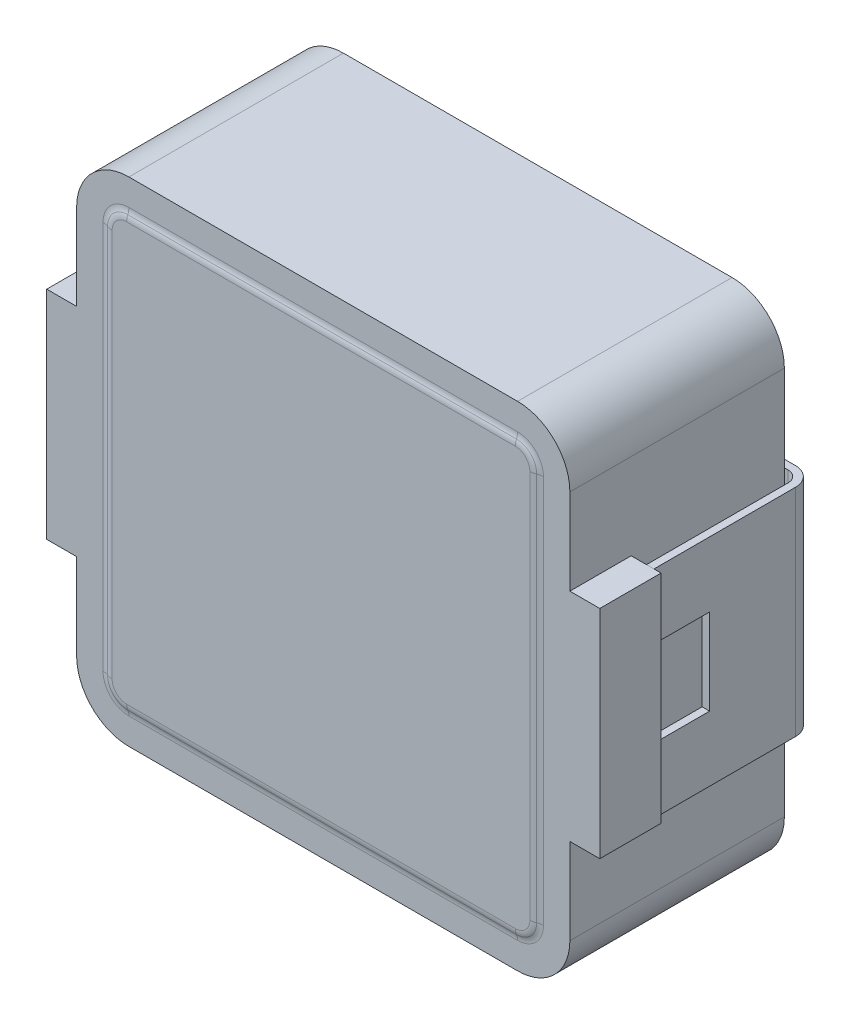
from build123d import *

# Parameters (mm, degrees)
SKETCH1_W            = 6.6
SKETCH1_H            = 6.6
BOSS_EXTRUDE1_DEPTH  = 2.9
SKETCH6_W            = 7.4
SKETCH6_H            = 2.9
BOSS_EXTRUDE5_DEPTH  = 0.85
FILLET1_R            = 0.7
SKETCH2_W            = 0.9
SKETCH2_H            = 2.1
CUT_EXTRUDE1_DEPTH   = 0.05
SKETCH3_W            = 1.3
SKETCH3_H            = 2.89
BOSS_EXTRUDE2_DEPTH  = 0.15
SKETCH4_W            = 0.3
SKETCH4_H            = 2.89
BOSS_EXTRUDE3_DEPTH  = 2
FILLET2_R            = 0.25
BOSS_EXTRUDE4_DEPTH  = 0.1
FILLET3_R            = 0.05
FILLET4_R            = 0.05
SKETCH8_W            = 0.2
SKETCH8_H            = 2.89
CUT_EXTRUDE2_DEPTH   = 2.05
FILLET5_R            = 0.15
SKETCH9_W            = 0.75
SKETCH9_H            = 1.15
CUT_EXTRUDE3_DEPTH   = 0.1
FILLET2_OF_MIRROR2_R = 0.25
FILLET5_OF_MIRROR2_R = 0.15
SKETCH10_W           = 10
SKETCH10_H           = 10
CUT_EXTRUDE4_DEPTH   = 0.03
FILLET6_R            = 0.2
FILLET7_R            = 0.2


# Some blends are built 0.0001 mm under size
with BuildPart() as part:
    # Sketch1 → Boss-Extrude1 (new body)
    with BuildSketch(Plane.XY):
        Rectangle(SKETCH1_W, SKETCH1_H)
    extrude(amount=BOSS_EXTRUDE1_DEPTH)

    # Sketch6 → Boss-Extrude5 (add)
    with BuildSketch(Plane.XY.offset(2.9)):
        Rectangle(SKETCH6_W, SKETCH6_H)
    extrude(amount=-BOSS_EXTRUDE5_DEPTH)

    # Fillet1
    fillet1_edges = [part.edges().sort_by_distance(p)[0] for p in [
        (3.3, -3.3, 1.45),
        (-3.3, -3.3, 1.45),
        (-3.3, 3.3, 1.45),
        (3.3, 3.3, 1.45),
    ]]
    fillet(fillet1_edges, radius=FILLET1_R)

    # Sketch2 → Cut-Extrude1 (cut)
    with BuildSketch(Plane(origin=(0, 0, 0), x_dir=(-1, 0, 0), z_dir=(0, 0, -1))):
        with Locations((2.85, 0)):
            Rectangle(SKETCH2_W, SKETCH2_H)
        with Locations((-2.85, 0)):
            Rectangle(SKETCH2_W, SKETCH2_H)
    extrude(amount=-CUT_EXTRUDE1_DEPTH, mode=Mode.SUBTRACT)

    # Sketch3 → Boss-Extrude2 (add)
    with BuildSketch(Plane(origin=(0, 0, 0.05), x_dir=(-1, 0, 0), z_dir=(0, 0, -1))):
        with Locations((2.95, 0)):
            Rectangle(SKETCH3_W, SKETCH3_H)
    boss_extrude2 = extrude(amount=BOSS_EXTRUDE2_DEPTH)

    # Sketch4 → Boss-Extrude3 (add)
    with BuildSketch(Plane.XY.offset(0.05)):
        with Locations((-3.45, 0)):
            Rectangle(SKETCH4_W, SKETCH4_H)
    boss_extrude3 = extrude(amount=BOSS_EXTRUDE3_DEPTH)

    # Fillet2
    fillet2_edges = [part.edges().sort_by_distance(p)[0] for p in [
        (-3.6, 0, -0.1),
    ]]
    fillet(fillet2_edges, radius=FILLET2_R)

    # Sketch5 → Boss-Extrude4 (add)
    with BuildSketch(Plane(origin=(0, 0, 0), x_dir=(-1, 0, 0), z_dir=(0, 0, -1))):
        Polygon((2.725, -2.7), (-2.725, -2.7), (-2.725, -1.8), (-1, -1.8), (-1, 1.8), (-2.725, 1.8), (-2.725, 2.7), (2.725, 2.7), (2.725, 1.8), (1, 1.8), (1, -1.8), (2.725, -1.8), align=None)
    extrude(amount=BOSS_EXTRUDE4_DEPTH)

    # Fillet3
    fillet3_edges = [part.edges().sort_by_distance(p)[0] for p in [
        (-2.725, -2.25, -0.1),
        (-1.8625, -1.8, -0.1),
        (-1, 0, -0.1),
        (-1.8625, 1.8, -0.1),
        (-2.725, 2.25, -0.1),
        (0, 2.7, -0.1),
        (2.725, 2.25, -0.1),
        (1.8625, 1.8, -0.1),
        (1, 0, -0.1),
        (1.8625, -1.8, -0.1),
        (2.725, -2.25, -0.1),
        (0, -2.7, -0.1),
    ]]
    fillet(fillet3_edges, radius=FILLET3_R)

    # Fillet4
    fillet4_edges = [part.edges().sort_by_distance(p)[0] for p in [
        (-1.8625, 1.8, 0),
        (-2.725, 2.25, 0),
        (0, 2.7, 0),
        (2.725, 2.25, 0),
        (1.8625, 1.8, 0),
        (1, 0, 0),
        (1.8625, -1.8, 0),
        (2.725, -2.25, 0),
        (0, -2.7, 0),
        (-1, 0, 0),
        (-2.725, -2.25, 0),
        (-1.8625, -1.8, 0),
    ]]
    fillet(fillet4_edges, radius=FILLET4_R - 0.0001)  # a hair under: the kernel refuses the full size

    # Sketch8 → Cut-Extrude2 (cut)
    with BuildSketch(Plane(origin=(0, 0, 0), x_dir=(-1, 0, 0), z_dir=(0, 0, -1))):
        with Locations((3.4, 0)):
            Rectangle(SKETCH8_W, SKETCH8_H)
    cut_extrude2 = extrude(amount=-CUT_EXTRUDE2_DEPTH, mode=Mode.SUBTRACT)

    # Fillet5
    fillet5_edges = [part.edges().sort_by_distance(p)[0] for p in [
        (-3.5, 0, 0),
    ]]
    fillet(fillet5_edges, radius=FILLET5_R)

    # Sketch9 → Cut-Extrude3 (cut)
    with BuildSketch(Plane.ZY.offset(3.6)):
        with Locations((1.675, 0)):
            Rectangle(SKETCH9_W, SKETCH9_H)
    cut_extrude3 = extrude(amount=-CUT_EXTRUDE3_DEPTH, mode=Mode.SUBTRACT)

    # Mirror2: Boss-Extrude2, Boss-Extrude3, Cut-Extrude2, Cut-Extrude3 across plane
    add(boss_extrude2.mirror(Plane(origin=(0, 0, 0), x_dir=(0, 0, 1), z_dir=(1, 0, 0))))
    add(boss_extrude3.mirror(Plane(origin=(0, 0, 0), x_dir=(0, 0, 1), z_dir=(1, 0, 0))))
    add(cut_extrude2.mirror(Plane(origin=(0, 0, 0), x_dir=(0, 0, 1), z_dir=(1, 0, 0))), mode=Mode.SUBTRACT)
    add(cut_extrude3.mirror(Plane(origin=(0, 0, 0), x_dir=(0, 0, 1), z_dir=(1, 0, 0))), mode=Mode.SUBTRACT)

    # Fillet2 of Mirror2
    fillet2_of_mirror2_edges = [part.edges().sort_by_distance(p)[0] for p in [
        (3.6, 0, -0.1),
    ]]
    fillet(fillet2_of_mirror2_edges, radius=FILLET2_OF_MIRROR2_R)

    # Fillet5 of Mirror2
    fillet5_of_mirror2_edges = [part.edges().sort_by_distance(p)[0] for p in [
        (3.5, 0, 0),
    ]]
    fillet(fillet5_of_mirror2_edges, radius=FILLET5_OF_MIRROR2_R)

    # Sketch10 → Cut-Extrude4 (cut)
    with BuildSketch(Plane.XY.offset(2.9)):
        with Locations((0.5029938, 0.413168945)):
            Rectangle(SKETCH10_W, SKETCH10_H)
        with BuildLine():
            Line((-2.6, 2.9), (2.6, 2.9))
            ThreePointArc((2.6, 2.9), (2.812132034, 2.812132034), (2.9, 2.6))
            Line((2.9, 2.6), (2.9, -2.6))
            ThreePointArc((2.9, -2.6), (2.812132034, -2.812132034), (2.6, -2.9))
            Line((2.6, -2.9), (-2.6, -2.9))
            ThreePointArc((-2.6, -2.9), (-2.812132034, -2.812132034), (-2.9, -2.6))
            Line((-2.9, -2.6), (-2.9, 2.6))
            ThreePointArc((-2.9, 2.6), (-2.812132034, 2.812132034), (-2.6, 2.9))
        make_face(mode=Mode.SUBTRACT)
    extrude(amount=-CUT_EXTRUDE4_DEPTH, mode=Mode.SUBTRACT)

    # Fillet6
    # the kernel refuses this fillet: 0.2 mm, written as the material it takes off along each edge
    with BuildSketch(Plane(origin=(-2.6, -2.6, 2.9), x_dir=(0, -1, 0), z_dir=(1, 0, 0))) as fillet6_piece_1:
        with BuildLine():
            CenterArc((0.194643462, 0.2), FILLET6_R, 270, 31.788330618)
            Line((0.194643462, 0), (0.194643462, -0.004))
            Line((0.194643462, -0.004), (0.3, -0.004))
            Line((0.3, -0.004), (0.304, 0))
            ThreePointArc((0.304, 0), (0.304, 0.015), (0.302107131, 0.0266))
            Line((0.302107131, 0.0266), (0.3, 0.03))
        make_face()
    revolve(axis=Axis((-2.6, -2.6, 2.9), (0, 0, -1)), revolution_arc=90, mode=Mode.SUBTRACT)
    with BuildSketch(Plane(origin=(-2.9, -2.6, 2.9), x_dir=(1.837049031358635e-11, 0, -1.0), z_dir=(0, 1, 0)), Plane(origin=(-2.6, 2.9, 2.9), x_dir=(0, -1.837049031358635e-11, -1.0), z_dir=(1, 0, 0)), Plane(origin=(2.9, 2.6, 2.9), x_dir=(-1.837049031358635e-11, 0, -1.0), z_dir=(0, -1, 0)), Plane(origin=(2.6, -2.9, 2.9), x_dir=(0, 1.837049031358635e-11, -1.0), z_dir=(-1, 0, 0))) as fillet6_piece_2:
        with BuildLine():
            CenterArc((0.2, -0.105356538), FILLET6_R, 148.211669384, 31.788330618)
            Line((0, -0.105356538), (-0.004, -0.105356538))
            Line((-0.004, -0.105356538), (-0.004, 0))
            Line((-0.004, 0), (0, 0.004))
            ThreePointArc((0, 0.004), (0.015, 0.004), (0.0266, 0.002107131))
            Line((0.0266, 0.002107131), (0.03, 0))
        make_face()
    extrude(amount=5.2, mode=Mode.SUBTRACT)
    with BuildSketch(Plane(origin=(-2.6, 2.6, 2.9), x_dir=(-1, 0, 0), z_dir=(0, -1, 0))) as fillet6_piece_3:
        with BuildLine():
            CenterArc((0.194643462, 0.2), FILLET6_R, 270, 31.788330618)
            Line((0.194643462, 0), (0.194643462, -0.004))
            Line((0.194643462, -0.004), (0.3, -0.004))
            Line((0.3, -0.004), (0.304, 0))
            ThreePointArc((0.304, 0), (0.304, 0.015), (0.302107131, 0.0266))
            Line((0.302107131, 0.0266), (0.3, 0.03))
        make_face()
    revolve(axis=Axis((-2.6, 2.6, 2.9), (0, 0, -1)), revolution_arc=90, mode=Mode.SUBTRACT)
    with BuildSketch(Plane(origin=(2.6, 2.6, 2.9), x_dir=(0, 1, 0), z_dir=(-1, 0, 0))) as fillet6_piece_4:
        with BuildLine():
            CenterArc((0.194643462, 0.2), FILLET6_R, 270, 31.788330618)
            Line((0.194643462, 0), (0.194643462, -0.004))
            Line((0.194643462, -0.004), (0.3, -0.004))
            Line((0.3, -0.004), (0.304, 0))
            ThreePointArc((0.304, 0), (0.304, 0.015), (0.302107131, 0.0266))
            Line((0.302107131, 0.0266), (0.3, 0.03))
        make_face()
    revolve(axis=Axis((2.6, 2.6, 2.9), (0, 0, -1)), revolution_arc=90, mode=Mode.SUBTRACT)
    with BuildSketch(Plane(origin=(2.6, -2.6, 2.9), x_dir=(1, 0, 0), z_dir=(0, 1, 0))) as fillet6_piece_5:
        with BuildLine():
            CenterArc((0.194643462, 0.2), FILLET6_R, 270, 31.788330618)
            Line((0.194643462, 0), (0.194643462, -0.004))
            Line((0.194643462, -0.004), (0.3, -0.004))
            Line((0.3, -0.004), (0.304, 0))
            ThreePointArc((0.304, 0), (0.304, 0.015), (0.302107131, 0.0266))
            Line((0.302107131, 0.0266), (0.3, 0.03))
        make_face()
    revolve(axis=Axis((2.6, -2.6, 2.9), (0, 0, -1)), revolution_arc=90, mode=Mode.SUBTRACT)

    # Fillet7
    fillet7_edges = [part.edges().sort_by_distance(p)[0] for p in [
        (0, 2.9, 2.87),
        (-2.812132034, 2.812132034, 2.87),
        (-2.9, 0, 2.87),
        (-2.812132034, -2.812132034, 2.87),
        (0, -2.9, 2.87),
        (2.812132034, -2.812132034, 2.87),
        (2.9, 0, 2.87),
        (2.812132034, 2.812132034, 2.87),
    ]]
    fillet(fillet7_edges, radius=FILLET7_R)


solid = part.part
